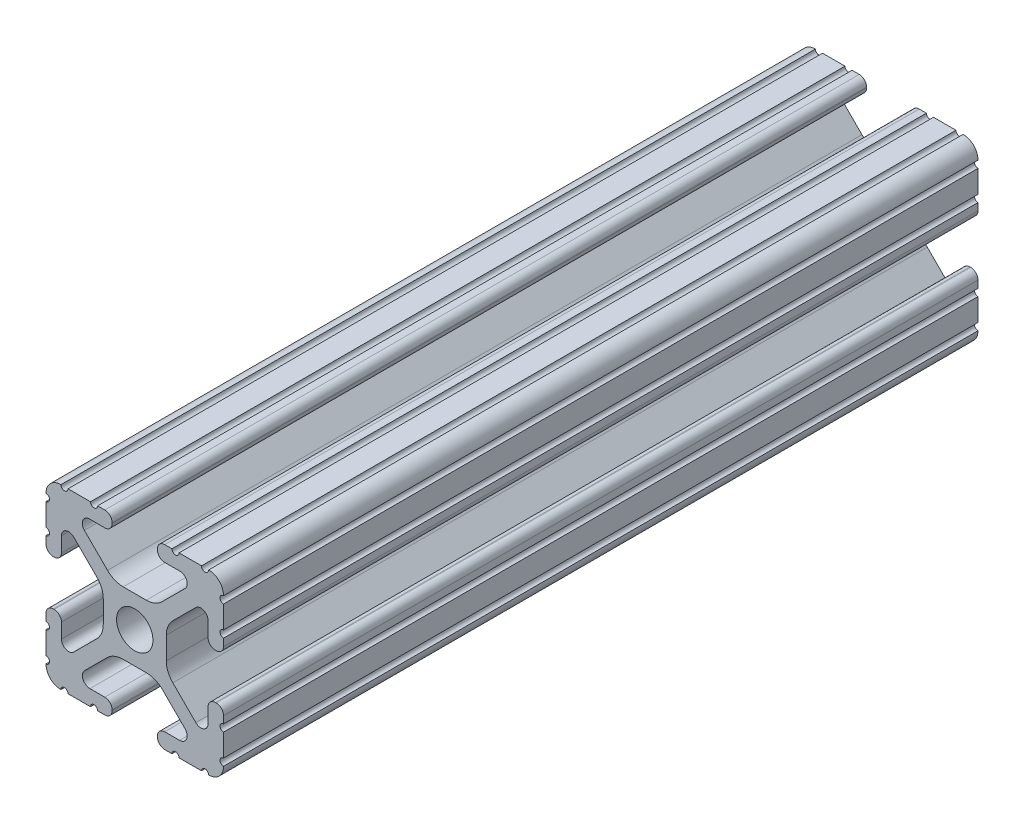
from build123d import *

# Parameters (mm, degrees)
SKETCH1_R           = 2.6035
BOSS_EXTRUDE1_DEPTH = 152.4
SKETCH2_R           = 22.79263682
CUT_EXTRUDE1_DEPTH  = 196.85


with BuildPart() as part:
    # Sketch1 → Boss-Extrude1 (new, symmetric)
    with BuildSketch(Plane.XY):
        with BuildLine():
            Line((-7.179650497, -8.645192506), (-3.952270251, -5.423690499))
            ThreePointArc((-3.952270251, -5.423690499), (-2.922936451, -4.736929036), (-1.709253557, -4.4958))
            Line((-1.709253557, -4.4958), (1.709253557, -4.4958))
            ThreePointArc((1.709253557, -4.4958), (2.922936451, -4.736929036), (3.952270251, -5.423690499))
            Line((3.952270251, -5.423690499), (7.179650497, -8.645192506))
            ThreePointArc((7.179650497, -8.645192506), (7.41473083, -9.822813117), (6.416408329, -10.4902))
            Line((6.416408329, -10.4902), (4.287512407, -10.4902))
            ThreePointArc((4.287512407, -10.4902), (3.54574862, -10.79744862), (3.2385, -11.539212407))
            Line((3.2385, -11.539212407), (3.2385, -11.650987593))
            ThreePointArc((3.2385, -11.650987593), (3.54574862, -12.39275138), (4.287512407, -12.7))
            Line((4.287512407, -12.7), (5.317126718, -12.7))
            ThreePointArc((5.317126718, -12.7), (5.825126718, -12.192), (6.333126718, -12.7))
            Line((6.333126718, -12.7), (9.550443118, -12.7))
            ThreePointArc((9.550443118, -12.7), (10.058366869, -12.192000006), (10.566443095, -12.699847501))
            ThreePointArc((10.566443095, -12.699847501), (12.082537762, -12.08250727), (12.699846982, -10.566399977))
            ThreePointArc((12.699846982, -10.566399977), (12.192000006, -10.058323491), (12.7, -9.5504))
            Line((12.7, -9.5504), (12.7, -6.3330836))
            ThreePointArc((12.7, -6.3330836), (12.192, -5.8250836), (12.7, -5.3170836))
            Line((12.7, -5.3170836), (12.7, -4.287469289))
            ThreePointArc((12.7, -4.287469289), (12.39275138, -3.545705502), (11.650987593, -3.238456882))
            Line((11.650987593, -3.238456882), (11.539212407, -3.238456882))
            ThreePointArc((11.539212407, -3.238456882), (10.79744862, -3.545705502), (10.4902, -4.287469289))
            Line((10.4902, -4.287469289), (10.4902, -6.402089023))
            ThreePointArc((10.4902, -6.402089023), (9.856505071, -7.351067942), (8.737131347, -7.129408934))
            Line((8.737131347, -7.129408934), (5.441005833, -3.840816462))
            ThreePointArc((5.441005833, -3.840816462), (4.750877967, -2.809883091), (4.5085, -1.593185507))
            Line((4.5085, -1.593185507), (4.5085, 1.593185507))
            ThreePointArc((4.5085, 1.593185507), (4.750877967, 2.809883091), (5.441005833, 3.840816462))
            Line((5.441005833, 3.840816462), (8.737131347, 7.129408934))
            ThreePointArc((8.737131347, 7.129408934), (9.856505071, 7.351067942), (10.4902, 6.402089023))
            Line((10.4902, 6.402089023), (10.4902, 4.287469289))
            ThreePointArc((10.4902, 4.287469289), (10.79744862, 3.545705502), (11.539212407, 3.238456882))
            Line((11.539212407, 3.238456882), (11.650987593, 3.238456882))
            ThreePointArc((11.650987593, 3.238456882), (12.39275138, 3.545705502), (12.7, 4.287469289))
            Line((12.7, 4.287469289), (12.7, 5.3170836))
            ThreePointArc((12.7, 5.3170836), (12.192, 5.8250836), (12.7, 6.3330836))
            Line((12.7, 6.3330836), (12.7, 9.5504))
            ThreePointArc((12.7, 9.5504), (12.192000006, 10.058323491), (12.699846982, 10.566399977))
            ThreePointArc((12.699846982, 10.566399977), (12.082537762, 12.08250727), (10.566443095, 12.699847501))
            ThreePointArc((10.566443095, 12.699847501), (10.058366869, 12.192000006), (9.550443118, 12.7))
            Line((9.550443118, 12.7), (6.333126718, 12.7))
            ThreePointArc((6.333126718, 12.7), (5.825126718, 12.192), (5.317126718, 12.7))
            Line((5.317126718, 12.7), (4.287512407, 12.7))
            ThreePointArc((4.287512407, 12.7), (3.54574862, 12.39275138), (3.2385, 11.650987593))
            Line((3.2385, 11.650987593), (3.2385, 11.539212407))
            ThreePointArc((3.2385, 11.539212407), (3.54574862, 10.79744862), (4.287512407, 10.4902))
            Line((4.287512407, 10.4902), (6.476788598, 10.4902))
            ThreePointArc((6.476788598, 10.4902), (7.432222385, 9.85140422), (7.207036008, 8.724370562))
            Line((7.207036008, 8.724370562), (3.898272566, 5.423169045))
            ThreePointArc((3.898272566, 5.423169045), (2.869120213, 4.736787962), (1.655778399, 4.4958))
            Line((1.655778399, 4.4958), (-1.655778399, 4.4958))
            ThreePointArc((-1.655778399, 4.4958), (-2.869120213, 4.736787962), (-3.898272566, 5.423169045))
            Line((-3.898272566, 5.423169045), (-7.207036008, 8.724370562))
            ThreePointArc((-7.207036008, 8.724370562), (-7.432222385, 9.85140422), (-6.476788598, 10.4902))
            Line((-6.476788598, 10.4902), (-4.287512407, 10.4902))
            ThreePointArc((-4.287512407, 10.4902), (-3.54574862, 10.79744862), (-3.2385, 11.539212407))
            Line((-3.2385, 11.539212407), (-3.2385, 11.650987593))
            ThreePointArc((-3.2385, 11.650987593), (-3.54574862, 12.39275138), (-4.287512407, 12.7))
            Line((-4.287512407, 12.7), (-5.317126718, 12.7))
            ThreePointArc((-5.317126718, 12.7), (-5.825126718, 12.192), (-6.333126718, 12.7))
            Line((-6.333126718, 12.7), (-9.550443118, 12.7))
            ThreePointArc((-9.550443118, 12.7), (-10.058366869, 12.192000006), (-10.566443095, 12.699847501))
            ThreePointArc((-10.566443095, 12.699847501), (-12.082537762, 12.08250727), (-12.699846982, 10.566399977))
            ThreePointArc((-12.699846982, 10.566399977), (-12.192000006, 10.058323491), (-12.7, 9.5504))
            Line((-12.7, 9.5504), (-12.7, 6.3330836))
            ThreePointArc((-12.7, 6.3330836), (-12.192, 5.8250836), (-12.7, 5.3170836))
            Line((-12.7, 5.3170836), (-12.7, 4.287469289))
            ThreePointArc((-12.7, 4.287469289), (-12.39275138, 3.545705502), (-11.650987593, 3.238456882))
            Line((-11.650987593, 3.238456882), (-11.539212407, 3.238456882))
            ThreePointArc((-11.539212407, 3.238456882), (-10.79744862, 3.545705502), (-10.4902, 4.287469289))
            Line((-10.4902, 4.287469289), (-10.4902, 6.402089023))
            ThreePointArc((-10.4902, 6.402089023), (-9.856505071, 7.351067942), (-8.737131347, 7.129408934))
            Line((-8.737131347, 7.129408934), (-5.441005833, 3.840816462))
            ThreePointArc((-5.441005833, 3.840816462), (-4.750877967, 2.809883091), (-4.5085, 1.593185507))
            Line((-4.5085, 1.593185507), (-4.5085, -1.593185507))
            ThreePointArc((-4.5085, -1.593185507), (-4.750877967, -2.809883091), (-5.441005833, -3.840816462))
            Line((-5.441005833, -3.840816462), (-8.737131347, -7.129408934))
            ThreePointArc((-8.737131347, -7.129408934), (-9.856505071, -7.351067942), (-10.4902, -6.402089023))
            Line((-10.4902, -6.402089023), (-10.4902, -4.287469289))
            ThreePointArc((-10.4902, -4.287469289), (-10.79744862, -3.545705502), (-11.539212407, -3.238456882))
            Line((-11.539212407, -3.238456882), (-11.650987593, -3.238456882))
            ThreePointArc((-11.650987593, -3.238456882), (-12.39275138, -3.545705502), (-12.7, -4.287469289))
            Line((-12.7, -4.287469289), (-12.7, -5.3170836))
            ThreePointArc((-12.7, -5.3170836), (-12.192, -5.8250836), (-12.7, -6.3330836))
            Line((-12.7, -6.3330836), (-12.7, -9.5504))
            ThreePointArc((-12.7, -9.5504), (-12.192000006, -10.058323491), (-12.699846982, -10.566399977))
            ThreePointArc((-12.699846982, -10.566399977), (-12.082537762, -12.08250727), (-10.566443095, -12.699847501))
            ThreePointArc((-10.566443095, -12.699847501), (-10.058366869, -12.192000006), (-9.550443118, -12.7))
            Line((-9.550443118, -12.7), (-6.333126718, -12.7))
            ThreePointArc((-6.333126718, -12.7), (-5.825126718, -12.192), (-5.317126718, -12.7))
            Line((-5.317126718, -12.7), (-4.287512407, -12.7))
            ThreePointArc((-4.287512407, -12.7), (-3.54574862, -12.39275138), (-3.2385, -11.650987593))
            Line((-3.2385, -11.650987593), (-3.2385, -11.539212407))
            ThreePointArc((-3.2385, -11.539212407), (-3.54574862, -10.79744862), (-4.287512407, -10.4902))
            Line((-4.287512407, -10.4902), (-6.416408329, -10.4902))
            ThreePointArc((-6.416408329, -10.4902), (-7.41473083, -9.822813117), (-7.179650497, -8.645192506))
        make_face()
        Circle(SKETCH1_R, mode=Mode.SUBTRACT)
    extrude(amount=BOSS_EXTRUDE1_DEPTH, both=True)

    # Sketch2 → Cut-Extrude1 (cut)
    with BuildSketch(Plane.XY.offset(152.4)):
        Circle(SKETCH2_R)
    extrude(amount=-CUT_EXTRUDE1_DEPTH, mode=Mode.SUBTRACT)


solid = part.part
